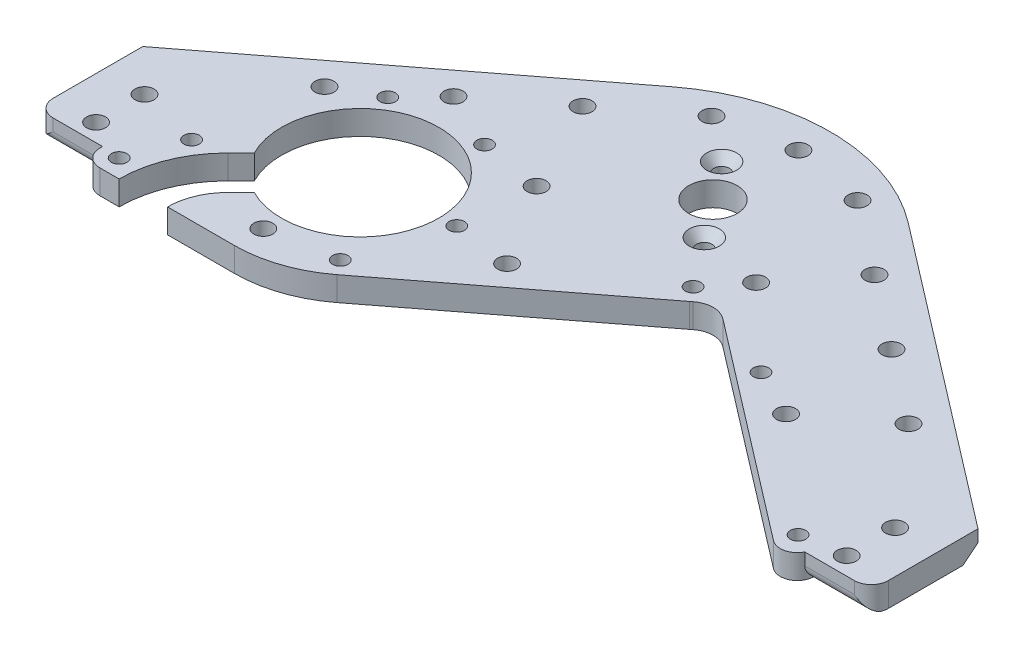
from build123d import *

# Parameters (mm, degrees)
SKETCH3_R                          = 20.6375
SKETCH3_R_2                        = 6.35
BOSS_EXTRUDE1_DEPTH                = 6.35
SKETCH8_W                          = 4.7498
SKETCH8_H                          = 41.275
BOSS_EXTRUDE4_DEPTH                = 6.35
SKETCH9_R                          = 2.032
COLLAR_HOLES_DEPTH                 = 135.407879484
SKETCH10_R                         = 2.0193
SPACER_HOLES_DEPTH                 = 135.407879484
SPACER_HOLE_PATTERN_COUNT          = 5
SPACER_HOLE_PATTERN_PITCH          = 24.13
SPACER_HOLE_MIRROR_COPY_1_SKETCH_R = 2.0193
SPACER_HOLE_MIRROR_COPY_1_DEPTH    = 135.407879484
SPACER_HOLE_MIRROR_COPY_2_SKETCH_R = 2.0193
SPACER_HOLE_MIRROR_COPY_2_DEPTH    = 135.407879484
SPACER_HOLE_MIRROR_COPY_3_SKETCH_R = 2.0193
SPACER_HOLE_MIRROR_COPY_3_DEPTH    = 135.407879484
SPACER_HOLE_MIRROR_COPY_4_SKETCH_R = 2.0193
SPACER_HOLE_MIRROR_COPY_4_DEPTH    = 135.407879484
SPACER_HOLE_MIRROR_COPY_5_SKETCH_R = 2.0193
SPACER_HOLE_MIRROR_COPY_5_DEPTH    = 135.407879484
SKETCH16_R                         = 2.0193
CUSTOM_NUTSTRIP_HOLES_DEPTH        = 135.407879484
SKETCH36_R                         = 2.0193
AUX_SPACER_HOLES_DEPTH             = 135.407879484
SKETCH49_R                         = 2.0193
CUT_EXTRUDE23_DEPTH                = 135.407879484
SKETCH50_R                         = 2.0193
CUT_EXTRUDE24_DEPTH                = 135.407879484
SKETCH58_R                         = 2.0193
CUT_EXTRUDE30_DEPTH                = 135.407879484
SKETCH11_R                         = 2.4892
ENLARGE_SPACER_HOLES_DEPTH         = 135.407879484
TOP_CHAMFER_SIZE                   = 1.905
TOP_CHAMFER_SIZE2                  = 2.54
CUT_EXTRUDE34_DEPTH                = 135.407879484
CUT_EXTRUDE52_DEPTH                = 135.407879484
SKETCH110_W                        = 17.4498
SKETCH110_H                        = 9.652
CUT_EXTRUDE56_DEPTH                = 135.407879484
CHAMFER4_SIZE                      = 3.175
FILLET21_R                         = 6.35
FILLET41_R                         = 4.445
FILLET45_R                         = 3.175


with BuildPart() as part:
    # Sketch3 → Boss-Extrude1 (new body)
    with BuildSketch(Plane(origin=(0, 25.4, 0), x_dir=(1, 0, 0), z_dir=(0, 1, 0))):
        with BuildLine():
            Line((-104.775, -36.374686106), (-30.925080594, 20.292350114))
            Line((-30.925080594, 20.292350114), (0, 44.021999059))
            Line((0, 44.021999059), (30.925080594, 20.292350114))
            Line((30.925080594, 20.292350114), (104.775, -36.374686106))
            Line((104.775, -36.374686106), (104.775, -77.649686106))
            Line((104.775, -77.649686106), (92.075, -77.649686106))
            Line((92.075, -77.649686106), (92.075, -74.653632333))
            Line((92.075, -74.653632333), (24.142327736, -22.527059539))
            ThreePointArc((24.142327736, -22.527059539), (22.197769032, -24.445438225), (20.101302386, -26.196527296))
            Line((20.101302386, -26.196527296), (-32.251449857, -66.368206988))
            ThreePointArc((-32.251449857, -66.368206988), (-41.738821099, -71.439312567), (-52.352752243, -73.191679691))
            Line((-52.352752243, -73.191679691), (-92.075, -73.191679691))
            Line((-92.075, -73.191679691), (-92.075, -77.649686106))
            Line((-92.075, -77.649686106), (-104.775, -77.649686106))
            Line((-104.775, -77.649686106), (-104.775, -36.374686106))
        make_face()
        with Locations(Location((-52.352752243, -40.171679691, 0), (0, 0, 270))):
            Circle(SKETCH3_R, mode=Mode.SUBTRACT)
        with Locations(Location((0, 0, 0), (0, 0, 270))):
            Circle(SKETCH3_R_2, mode=Mode.SUBTRACT)
    extrude(amount=-BOSS_EXTRUDE1_DEPTH)

    # Sketch8 → Boss-Extrude4 (add, through all)
    with BuildSketch(Plane(origin=(0, 25.4, 0), x_dir=(1, 0, 0), z_dir=(0, 1, 0))):
        with Locations((-107.1499, -57.012186106)):
            Rectangle(SKETCH8_W, SKETCH8_H)
        with Locations((107.1499, -57.012186106)):
            Rectangle(SKETCH8_W, SKETCH8_H)
    extrude(amount=-BOSS_EXTRUDE4_DEPTH)

    # Sketch9 → Collar Holes (cut, through all)
    with BuildSketch(Plane(origin=(0, 25.4, 0), x_dir=(1, 0, 0), z_dir=(0, 1, 0))):
        with Locations(Location((-7.491600774, 9.763244212, 0), (0, 0, 270))):
            Circle(SKETCH9_R)
        with Locations(Location((7.491600774, -9.763244212, 0), (0, 0, 270))):
            Circle(SKETCH9_R)
    extrude(amount=-COLLAR_HOLES_DEPTH, mode=Mode.SUBTRACT)

    # Sketch10 → Spacer Holes (cut, through all)
    with BuildSketch(Plane(origin=(0, 25.4, 0), x_dir=(1, 0, 0), z_dir=(0, 1, 0))):
        with Locations(Location((0, 33.456719285, 0), (0, 0, 270))):
            Circle(SKETCH10_R)
    spacer_holes = extrude(amount=-SPACER_HOLES_DEPTH, mode=Mode.SUBTRACT)

    # Spacer Hole Pattern: Spacer Holes ×5
    with Locations(*[Vector(-0.7933533402912316, 0, 0.6087614290087253) * (i * SPACER_HOLE_PATTERN_PITCH) for i in range(1, SPACER_HOLE_PATTERN_COUNT)]):
        add(spacer_holes, mode=Mode.SUBTRACT)

    # Spacer Hole Mirror copy 1 sketch → Spacer Hole Mirror copy 1 (cut, through all)
    with BuildSketch(Plane(origin=(19.143616101, 25.4, 14.689413282), x_dir=(-1, 0, 0), z_dir=(0, 1, 0))):
        with Locations((0, -33.456719285)):
            Circle(SPACER_HOLE_MIRROR_COPY_1_SKETCH_R)
    extrude(amount=-SPACER_HOLE_MIRROR_COPY_1_DEPTH, mode=Mode.SUBTRACT)

    # Spacer Hole Mirror copy 2 sketch → Spacer Hole Mirror copy 2 (cut, through all)
    with BuildSketch(Plane(origin=(38.287232202, 25.4, 29.378826564), x_dir=(-1, 0, 0), z_dir=(0, 1, 0))):
        with Locations((0, -33.456719285)):
            Circle(SPACER_HOLE_MIRROR_COPY_2_SKETCH_R)
    extrude(amount=-SPACER_HOLE_MIRROR_COPY_2_DEPTH, mode=Mode.SUBTRACT)

    # Spacer Hole Mirror copy 3 sketch → Spacer Hole Mirror copy 3 (cut, through all)
    with BuildSketch(Plane(origin=(57.430848304, 25.4, 44.068239846), x_dir=(-1, 0, 0), z_dir=(0, 1, 0))):
        with Locations((0, -33.456719285)):
            Circle(SPACER_HOLE_MIRROR_COPY_3_SKETCH_R)
    extrude(amount=-SPACER_HOLE_MIRROR_COPY_3_DEPTH, mode=Mode.SUBTRACT)

    # Spacer Hole Mirror copy 4 sketch → Spacer Hole Mirror copy 4 (cut, through all)
    with BuildSketch(Plane(origin=(76.574464405, 25.4, 58.757653128), x_dir=(-1, 0, 0), z_dir=(0, 1, 0))):
        with Locations((0, -33.456719285)):
            Circle(SPACER_HOLE_MIRROR_COPY_4_SKETCH_R)
    extrude(amount=-SPACER_HOLE_MIRROR_COPY_4_DEPTH, mode=Mode.SUBTRACT)

    # Spacer Hole Mirror copy 5 sketch → Spacer Hole Mirror copy 5 (cut, through all)
    with BuildSketch(Plane(origin=(0, 25.4, 0), x_dir=(-1, 0, 0), z_dir=(0, 1, 0))):
        with Locations((0, -33.456719285)):
            Circle(SPACER_HOLE_MIRROR_COPY_5_SKETCH_R)
    extrude(amount=-SPACER_HOLE_MIRROR_COPY_5_DEPTH, mode=Mode.SUBTRACT)

    # Sketch16 → Custom Nutstrip Holes (cut, through all)
    with BuildSketch(Plane(origin=(0, 25.4, 0), x_dir=(1, 0, 0), z_dir=(0, 1, 0))):
        with Locations(Location((-98.425, -50.662186106, 0), (0, 0, 270))):
            Circle(SKETCH16_R)
        with Locations(Location((-98.425, -63.362186106, 0), (0, 0, 270))):
            Circle(SKETCH16_R)
        with Locations(Location((98.425, -63.362186106, 0), (0, 0, 90))):
            Circle(SKETCH16_R)
        with Locations(Location((98.425, -50.662186106, 0), (0, 0, 90))):
            Circle(SKETCH16_R)
    extrude(amount=-CUSTOM_NUTSTRIP_HOLES_DEPTH, mode=Mode.SUBTRACT)

    # Sketch36 → Aux Spacer Holes (cut, through all)
    with BuildSketch(Plane(origin=(0, 25.4, 0), x_dir=(1, 0, 0), z_dir=(0, 1, 0))):
        with Locations(Location((-52.352752243, -65.571679691, 0), (0, 0, 270))):
            Circle(SKETCH36_R)
        with Locations(Location((58.293943402, -39.127716128, 0), (0, 0, 270))):
            Circle(SKETCH36_R)
        with Locations(Location((24.512886804, -13.206599718, 0), (0, 0, 270))):
            Circle(SKETCH36_R)
        with Locations(Location((-12.439980265, -41.561531903, 0), (0, 0, 270))):
            Circle(SKETCH36_R)
        with Locations(Location((-26.176376122, -20.085839846, 0), (0, 0, 270))):
            Circle(SKETCH36_R)
    extrude(amount=-AUX_SPACER_HOLES_DEPTH, mode=Mode.SUBTRACT)

    # Sketch49 → Cut-Extrude23 (cut, through all)
    with BuildSketch(Plane(origin=(0, 25.4, 0), x_dir=(1, 0, 0), z_dir=(0, 1, 0))):
        with Locations(Location((-81.967180737, -54.776679691, 0), (0, 0, 270))):
            Circle(SKETCH49_R)
        with Locations(Location((-65.875779659, -19.424801504, 0), (0, 0, 270))):
            Circle(SKETCH49_R)
        with Locations(Location((-42.422737009, -17.484678513, 0), (0, 0, 270))):
            Circle(SKETCH49_R)
        with Locations(Location((-27.594740634, -39.583388821, 0), (0, 0, 270))):
            Circle(SKETCH49_R)
    extrude(amount=-CUT_EXTRUDE23_DEPTH, mode=Mode.SUBTRACT)

    # Sketch50 → Cut-Extrude24 (cut, through all)
    with BuildSketch(Plane(origin=(0, 25.4, 0), x_dir=(1, 0, 0), z_dir=(0, 1, 0))):
        with Locations(Location((-87.3125, -68.429179691, 0), (0, 0, 270))):
            Circle(SKETCH50_R)
        with Locations(Location((-35.150676163, -62.589861704, 0), (0, 0, 270))):
            Circle(SKETCH50_R)
        with Locations(Location((17.20207608, -22.418182013, 0), (0, 0, 270))):
            Circle(SKETCH50_R)
        with Locations(Location((45.531325629, -32.936414996, 0), (0, 0, 270))):
            Circle(SKETCH50_R)
        with Locations(Location((87.3125, -64.996237681, 0), (0, 0, 270))):
            Circle(SKETCH50_R)
    extrude(amount=-CUT_EXTRUDE24_DEPTH, mode=Mode.SUBTRACT)

    # Sketch58 → Cut-Extrude30 (cut, through all)
    with BuildSketch(Plane(origin=(0, 25.4, 0), x_dir=(1, 0, 0), z_dir=(0, 1, 0))):
        with Locations(Location((0, 22.408000428, 0), (0, 0, 270))):
            Circle(SKETCH58_R)
        with BuildLine():
            Line((-30.925080594, 20.292350114), (0, 44.021999059))
            Line((0, 44.021999059), (30.925080594, 20.292350114))
            ThreePointArc((30.925080594, 20.292350114), (0, 30.790000428), (-30.925080594, 20.292350114))
        make_face()
    extrude(amount=-CUT_EXTRUDE30_DEPTH, mode=Mode.SUBTRACT)

    # Sketch11 → Enlarge Spacer Holes (cut, through all)
    with BuildSketch(Plane(origin=(0, 25.4, 0), x_dir=(1, 0, 0), z_dir=(0, 1, 0))):
        with Locations(Location((0, 22.408000428, 0), (0, 0, 270))):
            Circle(SKETCH11_R)
        with Locations(Location((-76.574464405, -25.300933843, 0), (0, 0, 270))):
            Circle(SKETCH11_R)
        with Locations(Location((-57.430848304, -10.611520561, 0), (0, 0, 270))):
            Circle(SKETCH11_R)
        with Locations(Location((-38.287232202, 4.077892721, 0), (0, 0, 270))):
            Circle(SKETCH11_R)
        with Locations(Location((-19.143616101, 18.767306003, 0), (0, 0, 270))):
            Circle(SKETCH11_R)
        with Locations(Location((19.143616101, 18.767306003, 0), (0, 0, 270))):
            Circle(SKETCH11_R)
        with Locations(Location((38.287232202, 4.077892721, 0), (0, 0, 270))):
            Circle(SKETCH11_R)
        with Locations(Location((57.430848304, -10.611520561, 0), (0, 0, 270))):
            Circle(SKETCH11_R)
        with Locations(Location((76.574464405, -25.300933843, 0), (0, 0, 270))):
            Circle(SKETCH11_R)
        with Locations(Location((-52.352752243, -65.571679691, 0), (0, 0, 270))):
            Circle(SKETCH11_R)
        with Locations(Location((-98.425, -50.662186106, 0), (0, 0, 270))):
            Circle(SKETCH11_R)
        with Locations(Location((-98.425, -63.362186106, 0), (0, 0, 270))):
            Circle(SKETCH11_R)
        with Locations(Location((98.425, -50.662186106, 0), (0, 0, 270))):
            Circle(SKETCH11_R)
        with Locations(Location((98.425, -63.362186106, 0), (0, 0, 270))):
            Circle(SKETCH11_R)
        with Locations(Location((-26.176376122, -20.085839846, 0), (0, 0, 270))):
            Circle(SKETCH11_R)
        with Locations(Location((-12.439980265, -41.561531903, 0), (0, 0, 270))):
            Circle(SKETCH11_R)
        with Locations(Location((24.512886804, -13.206599718, 0), (0, 0, 270))):
            Circle(SKETCH11_R)
        with Locations(Location((58.293943402, -39.127716128, 0), (0, 0, 270))):
            Circle(SKETCH11_R)
    extrude(amount=-ENLARGE_SPACER_HOLES_DEPTH, mode=Mode.SUBTRACT)

    # Top Chamfer
    top_chamfer_edges = [part.edges().sort_by_distance(p)[0] for p in [
        (-7.491600774, 25.4, -11.795244212),
        (7.491600774, 25.4, 7.731244212),
    ]]
    top_chamfer_side = [part.faces().sort_by_distance(p)[0] for p in [
        (-0.702147429, 25.4, 26.179434033),
    ]]
    chamfer(top_chamfer_edges, length=TOP_CHAMFER_SIZE, length2=TOP_CHAMFER_SIZE2, reference=top_chamfer_side[0])

    # Sketch75 → Cut-Extrude34 (cut, through all)
    with BuildSketch(Plane(origin=(0, 25.4, 0), x_dir=(1, 0, 0), z_dir=(0, 1, 0))):
        Polygon((-104.775, -36.374686106), (-109.5248, -40.019335834), (-109.5248, -36.374686106), align=None)
        Polygon((104.775, -36.374686106), (109.5248, -40.019335834), (109.5248, -36.374686106), align=None)
    extrude(amount=-CUT_EXTRUDE34_DEPTH, mode=Mode.SUBTRACT)

    # Sketch101 → Cut-Extrude52 (cut, through all)
    with BuildSketch(Plane(origin=(0, 25.4, 0), x_dir=(1, 0, 0), z_dir=(0, 1, 0))):
        with BuildLine():
            Line((-61.747578382, -58.546761951), (-65.223756626, -62.022940195))
            ThreePointArc((-65.223756626, -62.022940195), (-68.64767852, -67.147201432), (-69.85, -73.191679691))
            Line((-69.85, -73.191679691), (-82.55, -73.191679691))
            ThreePointArc((-82.55, -73.191679691), (-80.380948583, -62.287121841), (-74.204012747, -53.042684074))
            Line((-74.204012747, -53.042684074), (-70.727834503, -49.56650583))
            Line((-70.727834503, -49.56650583), (-61.747578382, -58.546761951))
        make_face()
    extrude(amount=-CUT_EXTRUDE52_DEPTH, mode=Mode.SUBTRACT)

    # Sketch110 → Cut-Extrude56 (cut, through all)
    with BuildSketch(Plane(origin=(0, 25.4, 0), x_dir=(1, 0, 0), z_dir=(0, 1, 0))):
        with Locations((-100.7999, -72.823686106)):
            Rectangle(SKETCH110_W, SKETCH110_H)
        with Locations((100.7999, -72.823686106)):
            Rectangle(SKETCH110_W, SKETCH110_H)
    extrude(amount=-CUT_EXTRUDE56_DEPTH, mode=Mode.SUBTRACT)

    # Chamfer4
    chamfer4_edges = [part.edges().sort_by_distance(p)[0] for p in [
        (-70.224940297, 19.05, 9.86349286),
        (0, 19.05, -30.790000428),
        (70.224940297, 19.05, 9.86349286),
    ]]
    chamfer(chamfer4_edges, length=CHAMFER4_SIZE)

    # Fillet21
    fillet21_edges = [part.edges().sort_by_distance(p)[0] for p in [
        (24.142327736, 22.225, 22.527059539),
    ]]
    fillet(fillet21_edges, radius=FILLET21_R)

    # Fillet41
    # the kernel refuses this fillet: 4.445 mm, written as the material it takes off along each edge
    with BuildSketch(Plane(origin=(109.5248, 36.5125, 67.997686106), x_dir=(-1, 0, 0), z_dir=(0, -1, 0)), Plane(origin=(-109.5248, 36.5125, 67.997686106), x_dir=(0, 0, -1), z_dir=(0, -1, 0))) as fillet41_piece_1:
        with BuildLine():
            CenterArc((FILLET41_R, FILLET41_R), FILLET41_R, 180, 90)
            Line((0, FILLET41_R), (-FILLET41_R * 0.02, FILLET41_R))
            Line((-FILLET41_R * 0.02, FILLET41_R), (-FILLET41_R * 0.02, -FILLET41_R * 0.02))
            Line((-FILLET41_R * 0.02, -FILLET41_R * 0.02), (FILLET41_R, -FILLET41_R * 0.02))
            Line((FILLET41_R, -FILLET41_R * 0.02), (FILLET41_R, 0))
        make_face()
    extrude(amount=28.575, mode=Mode.SUBTRACT)
    with BuildSketch(Plane(origin=(92.075, 46.444130009, 74.653632333), x_dir=(-0.7933533402912316, 0, -0.6087614290087255), z_dir=(0, -1, 0))) as fillet41_piece_2:
        with BuildLine():
            CenterArc((8.417652003, 4.445), FILLET41_R, 169.165785029, 100.834214971)
            Line((4.051883336, 5.280517172), (3.964567963, 5.297227515))
            ThreePointArc((3.964567963, 5.297227515), (1.955412556, 2.694377477), (-0.070529112, 0.054118891))
            Line((-0.070529112, 0.054118891), (0, -0.0889))
            Line((0, -0.0889), (8.417652003, -0.0889))
            Line((8.417652003, -0.0889), (8.417652003, 0))
        make_face()
    extrude(amount=48.438260017, mode=Mode.SUBTRACT)
    with BuildSketch(Plane(origin=(-92.075, 36.5125, 73.191679691), x_dir=(1, 0, 0), z_dir=(0, -1, 0))) as fillet41_piece_3:
        with BuildLine():
            CenterArc((FILLET41_R, -FILLET41_R), FILLET41_R, 90, 90)
            Line((0, -FILLET41_R), (-FILLET41_R * 0.02, -FILLET41_R))
            Line((-FILLET41_R * 0.02, -FILLET41_R), (-FILLET41_R * 0.02, FILLET41_R * 0.02))
            Line((-FILLET41_R * 0.02, FILLET41_R * 0.02), (FILLET41_R, FILLET41_R * 0.02))
            Line((FILLET41_R, FILLET41_R * 0.02), (FILLET41_R, 0))
        make_face()
    extrude(amount=28.575, mode=Mode.SUBTRACT)

    # Fillet45
    # the kernel refuses this fillet: 3.175 mm, written as the material it takes off along each edge
    with BuildSketch(Plane(origin=(-113.0173, 19.05, 67.997686106), x_dir=(0, 1, 0), z_dir=(1, 0, 0))) as fillet45_piece_1:
        with BuildLine():
            CenterArc((FILLET45_R, -FILLET45_R), FILLET45_R, 90, 90)
            Line((0, -FILLET45_R), (0, 0))
            Line((0, 0), (FILLET45_R, 0))
        make_face()
    extrude(amount=20.9423, mode=Mode.SUBTRACT)
    with BuildSketch(Plane(origin=(113.0173, 19.05, 67.997686106), x_dir=(0, 1, 0), z_dir=(-1, 0, 0))) as fillet45_piece_2_section:
        with BuildLine():
            CenterArc((FILLET45_R, FILLET45_R), FILLET45_R, 180, 90)
            Line((0, FILLET45_R), (0, 0))
            Line((0, 0), (FILLET45_R, 0))
        make_face()
    fillet45_piece_2 = extrude(amount=28.8798, mode=Mode.PRIVATE)
    fillet45_piece_2 = fillet45_piece_2 - Plane(origin=(88.102772218, 19.593814114, 66.002834873), x_dir=(-0.7933533402910131, 0, -0.6087614290090101), z_dir=(0, 1, 0)) * Cylinder(4.445, 71, mode=Mode.PRIVATE)
    add(fillet45_piece_2, mode=Mode.SUBTRACT)


solid = part.part
